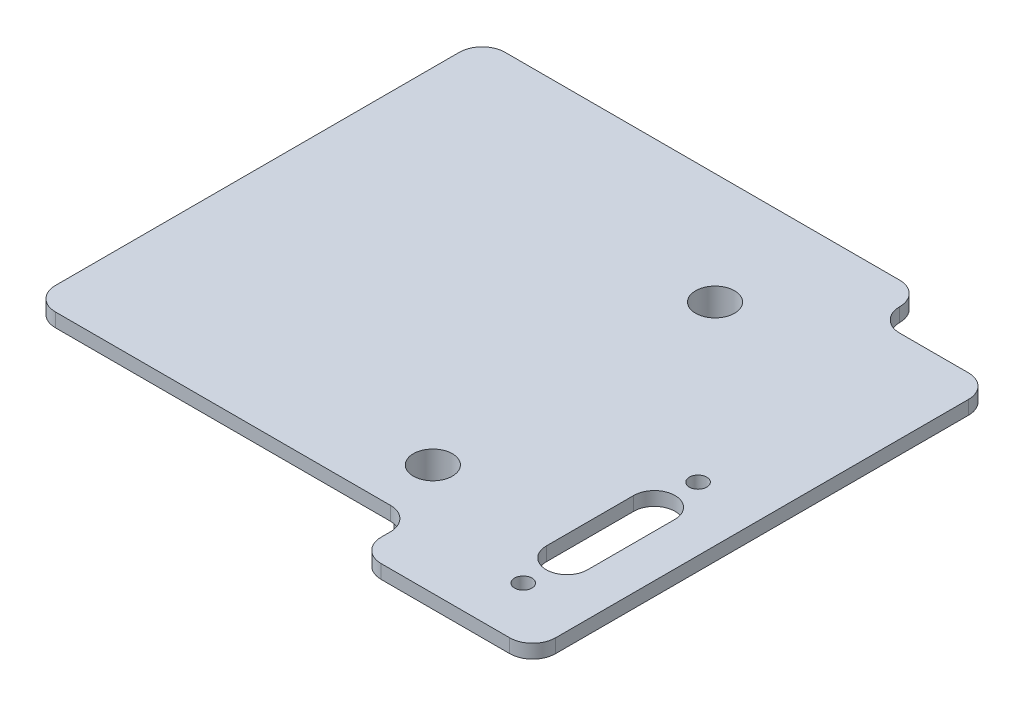
from build123d import *

# Parameters (mm, degrees)
PLATE_DEPTH           = 3
SKETCH2_R             = 6
MOUNT_POSTS_DEPTH     = 22
SKETCH3_R             = 4.25
MOUNT_CBORE_DEPTH     = 19.5
F_8_CLEARANCE_HOLE1_D = 4.4958
FILLET1_R             = 1.5
SKETCH7_R             = 1.9
TERMINAL_STRIP_DEPTH  = 159.962259672
CHAMFER1_SIZE         = 3
CHAMFER2_SIZE         = 1
FILLET3_R             = 1.5
CORNERS_R             = 5


# Some blends are built 0.0001 mm under size
with BuildPart() as part:
    # Sketch1 → plate (new body)
    with BuildSketch(Plane(origin=(0, 0, 0), x_dir=(1, 0, 0), z_dir=(0, 1, 0))):
        Polygon((0, 0), (83, 0), (83, -12), (121, -12), (121, 88), (96, 88), (96, 98), (0, 98), align=None)
    extrude(amount=PLATE_DEPTH)

    # Sketch2 → mount posts (add)
    with BuildSketch(Plane(origin=(0, 3, 0), x_dir=(1, 0, 0), z_dir=(0, 1, 0))):
        with Locations(Location((75, 73.75, 0), (0, 0, 270))):
            Circle(SKETCH2_R)
        with Locations(Location((75, 12.25, 0), (0, 0, 270))):
            Circle(SKETCH2_R)
    extrude(amount=-MOUNT_POSTS_DEPTH)

    # Sketch3 → mount cbore (cut)
    with BuildSketch(Plane(origin=(0, 3, 0), x_dir=(1, 0, 0), z_dir=(0, 1, 0))):
        with Locations(Location((75, 73.75, 0), (0, 0, 270))):
            Circle(SKETCH3_R)
        with Locations(Location((75, 12.25, 0), (0, 0, 270))):
            Circle(SKETCH3_R)
    extrude(amount=-MOUNT_CBORE_DEPTH, mode=Mode.SUBTRACT)

    # #8 Clearance Hole1 (through all)
    with Locations(Plane(origin=(0, -16.5, 0), x_dir=(1, 0, 0), z_dir=(0, 1, 0))):
        with Locations((75, 73.75), (75, 12.25)):
            Hole(F_8_CLEARANCE_HOLE1_D / 2)

    # Sketch8 → foot (revolve)
    with BuildSketch(Plane(origin=(0, 0, -43), x_dir=(1, 0, 0), z_dir=(0, 0, -1)), mode=Mode.PRIVATE) as foot_sk:
        Polygon((45.25, 0), (46.85, 0), (45.1, 29), (43.5, 29), align=None)
    revolve(foot_sk.sketch.rotate(Axis((40, 0, -43), (0, -1, 0)), 90), axis=Axis((40, 0, -43), (0, -1, 0)))

    # Fillet1
    fillet1_edges = [part.edges().sort_by_distance(p)[0] for p in [
        (40, 0, -48.25),
        (40, 0, -49.85),
    ]]
    fillet(fillet1_edges, radius=FILLET1_R)

    # Sketch7 → terminal strip (cut, through all)
    with BuildSketch(Plane(origin=(0, 3, 0), x_dir=(1, 0, 0), z_dir=(0, 1, 0))):
        with Locations(Location((107.15, 37.9, 0), (0, 0, 270))):
            Circle(SKETCH7_R)
        with Locations(Location((107.15, -0.2, 0), (0, 0, 270))):
            Circle(SKETCH7_R)
        with BuildLine():
            Line((102.65, 9.325), (102.65, 28.375))
            ThreePointArc((102.65, 28.375), (107.15, 32.875), (111.65, 28.375))
            Line((111.65, 28.375), (111.65, 9.325))
            ThreePointArc((111.65, 9.325), (107.15, 4.825), (102.65, 9.325))
        make_face()
    extrude(amount=-TERMINAL_STRIP_DEPTH, mode=Mode.SUBTRACT)

    # Chamfer1
    # the kernel refuses this chamfer: 3 mm, written as the material it adds along each edge
    with BuildSketch(Plane(origin=(75, -16.5, -73.75), x_dir=(0, 0, 1), z_dir=(-1, 0, 0))) as chamfer1_piece_1_section:
        Polygon((4.25, CHAMFER1_SIZE), (4.25 - CHAMFER1_SIZE, 0), (4.25, 0), align=None)
    chamfer1_piece_1 = revolve(axis=Axis((75, -16.5, -73.75), (0, 1, 0)), mode=Mode.PRIVATE)
    chamfer1_piece_1 = chamfer1_piece_1 - Plane(origin=(75, -14.490807126, -73.75), x_dir=(-1, 0, 0), z_dir=(0, -1, 0)) * Cylinder(2.2479, 17, mode=Mode.PRIVATE)
    add(chamfer1_piece_1)
    with BuildSketch(Plane(origin=(75, -16.5, -12.25), x_dir=(0, 0, 1), z_dir=(-1, 0, 0))) as chamfer1_piece_2_section:
        Polygon((4.25, CHAMFER1_SIZE), (4.25 - CHAMFER1_SIZE, 0), (4.25, 0), align=None)
    chamfer1_piece_2 = revolve(axis=Axis((75, -16.5, -12.25), (0, 1, 0)), mode=Mode.PRIVATE)
    chamfer1_piece_2 = chamfer1_piece_2 - Plane(origin=(75, -14.490807126, -12.25), x_dir=(-1, 0, 0), z_dir=(0, -1, 0)) * Cylinder(2.2479, 18, mode=Mode.PRIVATE)
    add(chamfer1_piece_2)

    # Chamfer2
    chamfer2_edges = [part.edges().sort_by_distance(p)[0] for p in [
        (75, -19, -79.75),
        (75, -19, -18.25),
    ]]
    chamfer(chamfer2_edges, length=CHAMFER2_SIZE)

    # Fillet3
    fillet3_edges = [part.edges().sort_by_distance(p)[0] for p in [
        (75, 0, -79.75),
        (75, 0, -18.25),
    ]]
    fillet(fillet3_edges, radius=FILLET3_R)

    # corners
    corners_edges = [part.edges().sort_by_distance(p)[0] for p in [
        (0, 1.5, -98),
        (96, 1.5, -98),
        (96, 1.5, -88),
        (121, 1.5, -88),
        (121, 1.5, 12),
        (83, 1.5, 12),
        (83, 1.5, 0),
        (0, 1.5, 0),
    ]]
    fillet(corners_edges, radius=CORNERS_R - 0.0001)  # a hair under: the kernel refuses the full size


solid = part.part
